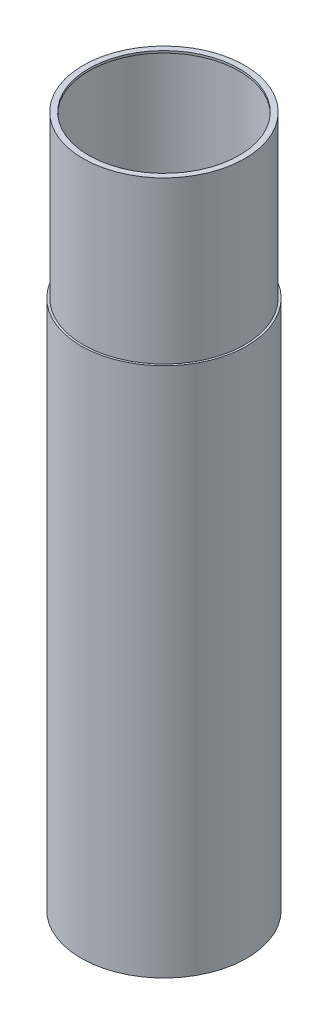
from build123d import *

# Parameters (mm, degrees)
SKETCH1_W                = 1.96
SKETCH1_H                = 500
BOSS_EXTRUDE1_DEPTH      = 152
BOSS_EXTRUDE1_DEPTH_BACK = 152
SKETCH3_R                = 76.2
SKETCH3_R_2              = 75.2
BOSS_EXTRUDE2_START      = -2
SKETCH4_R                = 76.2
SKETCH4_R_2              = 70.915017824
BOSS_EXTRUDE2_DEPTH      = 2


with BuildPart() as part:
    # Sketch1 → Revolve1 (revolve)
    with BuildSketch(Plane.XY):
        with Locations((77.18, 250)):
            Rectangle(SKETCH1_W, SKETCH1_H)
    revolve(axis=Axis((0, 204.615384615, 0), (0, -1, 0)))

    # Sketch3 → Boss-Extrude1 (add, two sides: drawn at the far end of the back side and taken through both)
    with BuildSketch(Plane(origin=(0, 500, 0), x_dir=(1, 0, 0), z_dir=(0, 1, 0)).offset(-BOSS_EXTRUDE1_DEPTH_BACK)):
        Circle(SKETCH3_R)
        Circle(SKETCH3_R_2, mode=Mode.SUBTRACT)
    extrude(amount=BOSS_EXTRUDE1_DEPTH + BOSS_EXTRUDE1_DEPTH_BACK)

    # Sketch4 → Boss-Extrude2 (add)
    with BuildSketch(Plane(origin=(0, 652, 0), x_dir=(1, 0, 0), z_dir=(0, 1, 0)).offset(BOSS_EXTRUDE2_START)):
        Circle(SKETCH4_R)
        Circle(SKETCH4_R_2, mode=Mode.SUBTRACT)
    extrude(amount=BOSS_EXTRUDE2_DEPTH)


solid = part.part
